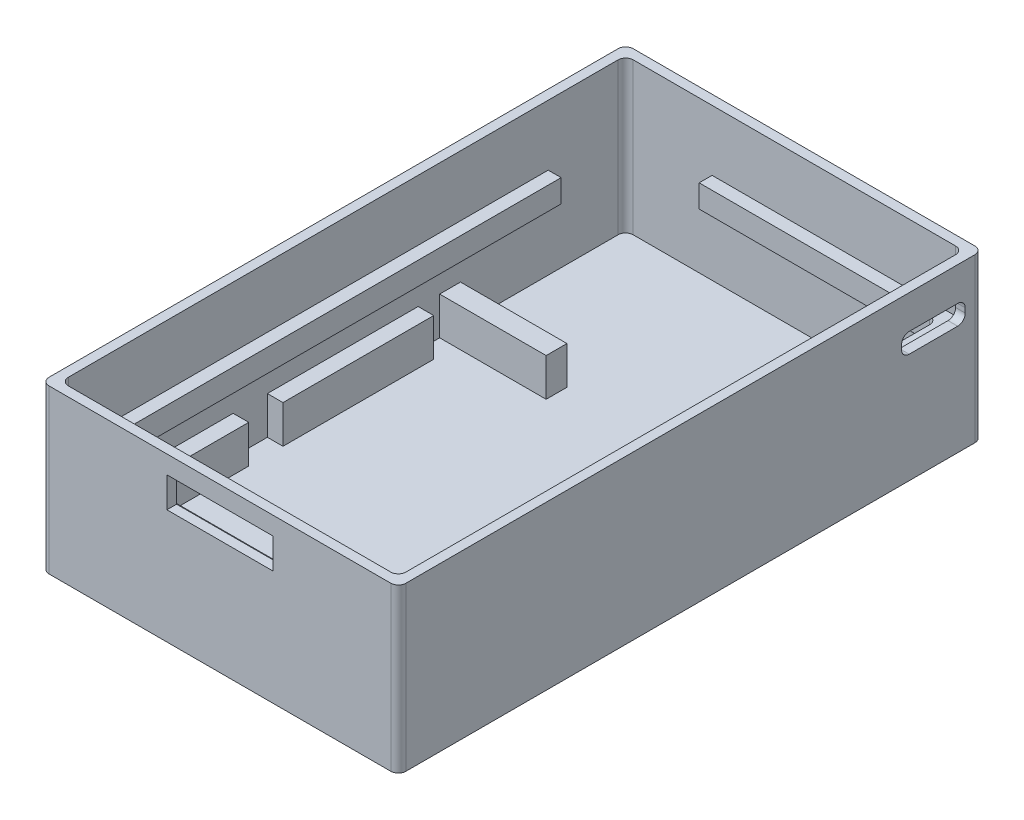
from build123d import *

# Parameters (mm, degrees)
SKETCH1_W           = 47.09116882
SKETCH1_H           = 77.09116882
BOSS_EXTRUDE1_DEPTH = 1.5
SKETCH2_W           = 47.09116882
SKETCH2_H           = 77.09116882
SKETCH2_W_2         = 44.545584412
SKETCH2_H_2         = 74.545584412
BOSS_EXTRUDE2_DEPTH = 20
FILLET4_R           = 1
SKETCH9_W           = 8.4
SKETCH9_H           = 2.6
CUT_EXTRUDE4_DEPTH  = 2
FILLET5_R           = 1
SKETCH10_W          = 2.5
SKETCH10_H          = 19.895622202
SKETCH10_W_2        = 15
SKETCH10_H_2        = 2.746977623
BOSS_EXTRUDE4_DEPTH = 5
SKETCH11_W          = 14
SKETCH11_H          = 4
CUT_EXTRUDE5_DEPTH  = 10
SKETCH12_W          = 75.09116882
SKETCH12_H          = 3
BOSS_EXTRUDE5_DEPTH = 46
SKETCH13_W          = 41.13137085
SKETCH13_H          = 71.13137085
CUT_EXTRUDE6_DEPTH  = 3
FILLET6_R           = 1
CUT_EXTRUDE8_DEPTH  = 3


with BuildPart() as part:
    # Sketch1 → Boss-Extrude1 (new body)
    with BuildSketch(Plane(origin=(0, 0, 0), x_dir=(1, 0, 0), z_dir=(0, 1, 0))):
        with Locations((23.54558441, -38.54558441)):
            Rectangle(SKETCH1_W, SKETCH1_H)
    extrude(amount=BOSS_EXTRUDE1_DEPTH)

    # Sketch2 → Boss-Extrude2 (add)
    with BuildSketch(Plane(origin=(0, 1.5, 0), x_dir=(1, 0, 0), z_dir=(0, 1, 0))):
        with Locations((23.54558441, -38.54558441)):
            Rectangle(SKETCH2_W, SKETCH2_H)
        with Locations((23.545584412, -38.545584412)):
            Rectangle(SKETCH2_W_2, SKETCH2_H_2, mode=Mode.SUBTRACT)
    extrude(amount=BOSS_EXTRUDE2_DEPTH)

    # Fillet4
    fillet4_edges = [part.edges().sort_by_distance(p)[0] for p in [
        (1.272792206, 11.5, 75.818376618),
        (45.818376618, 11.5, 75.818376618),
        (45.818376618, 11.5, 1.272792206),
        (1.272792206, 11.5, 1.272792206),
        (0, 10.75, 0),
        (47.09116882, 10.75, 0),
        (47.09116882, 10.75, 77.09116882),
        (0, 10.75, 77.09116882),
    ]]
    fillet(fillet4_edges, radius=FILLET4_R)

    # Sketch9 → Cut-Extrude4 (cut)
    with BuildSketch(Plane(origin=(47.09116882, 0, 0), x_dir=(0, 0, -1), z_dir=(1, 0, 0))):
        with Locations((-6.471655529, 15.764642051)):
            Rectangle(SKETCH9_W, SKETCH9_H)
    extrude(amount=-CUT_EXTRUDE4_DEPTH, mode=Mode.SUBTRACT)

    # Fillet5
    # the kernel refuses this fillet: 1 mm, written as the material it adds along each edge
    with BuildSketch(Plane(origin=(47.09116882, 17.064642051, 10.671655529), x_dir=(0, 0, -1), z_dir=(-1, 0, 0))) as fillet5_piece_1:
        with BuildLine():
            CenterArc((FILLET5_R, FILLET5_R), FILLET5_R, 180, 90)
            Line((0, FILLET5_R), (0, 0))
            Line((0, 0), (FILLET5_R, 0))
        make_face()
    extrude(amount=1.272792202)
    with BuildSketch(Plane(origin=(47.09116882, 14.464642051, 2.271655529), x_dir=(0, 0, 1), z_dir=(-1, 0, 0))) as fillet5_piece_2_section:
        with BuildLine():
            CenterArc((FILLET5_R, FILLET5_R), FILLET5_R, 180, 90)
            Line((0, FILLET5_R), (0, 0))
            Line((0, 0), (FILLET5_R, 0))
        make_face()
    fillet5_piece_2 = extrude(amount=3.772792848, mode=Mode.PRIVATE)
    fillet5_piece_2 = split(fillet5_piece_2, bisect_by=Plane(origin=(45.818376618, 14.688009946, 2.495023498), z_dir=(1, 0, 0)), keep=Keep.TOP, mode=Mode.PRIVATE)
    add(fillet5_piece_2)
    with BuildSketch(Plane(origin=(47.09116882, 17.064642051, 2.271655529), x_dir=(0, -1, 0), z_dir=(-1, 0, 0))) as fillet5_piece_3_section:
        with BuildLine():
            CenterArc((FILLET5_R, FILLET5_R), FILLET5_R, 180, 90)
            Line((0, FILLET5_R), (0, 0))
            Line((0, 0), (FILLET5_R, 0))
        make_face()
    fillet5_piece_3 = extrude(amount=3.772792848, mode=Mode.PRIVATE)
    fillet5_piece_3 = split(fillet5_piece_3, bisect_by=Plane(origin=(45.818376618, 16.841274155, 2.495023498), z_dir=(1, 0, 0)), keep=Keep.TOP, mode=Mode.PRIVATE)
    add(fillet5_piece_3)
    with BuildSketch(Plane(origin=(47.09116882, 14.464642051, 10.671655529), x_dir=(0, 0, -1), z_dir=(-1, 0, 0))) as fillet5_piece_4:
        with BuildLine():
            CenterArc((FILLET5_R, -FILLET5_R), FILLET5_R, 90, 90)
            Line((0, -FILLET5_R), (0, 0))
            Line((0, 0), (FILLET5_R, 0))
        make_face()
    extrude(amount=1.272792202)

    # Sketch10 → Boss-Extrude4 (add)
    with BuildSketch(Plane(origin=(0, 1.5, 0), x_dir=(1, 0, 0), z_dir=(0, 1, 0))):
        with Locations((2.082813384, -63.025844565)):
            Rectangle(SKETCH10_W, SKETCH10_H)
        with Locations((7.824900782, -24.444887807)):
            Rectangle(SKETCH10_W_2, SKETCH10_H_2)
        with Locations((39.244805213, -24.444887807)):
            Rectangle(SKETCH10_W_2, SKETCH10_H_2)
        with Locations((2.082813384, -38.610908672)):
            Rectangle(SKETCH10_W, SKETCH10_H)
        with Locations((45.295584412, -38.610908672)):
            Rectangle(SKETCH10_W, SKETCH10_H)
        with Locations((45.295584412, -63.025844565)):
            Rectangle(SKETCH10_W, SKETCH10_H)
    extrude(amount=BOSS_EXTRUDE4_DEPTH)

    # Sketch11 → Cut-Extrude5 (cut)
    with BuildSketch(Plane.XY.offset(77.09116882)):
        with Locations((23.545584412, 17.117945241)):
            Rectangle(SKETCH11_W, SKETCH11_H)
    extrude(amount=-CUT_EXTRUDE5_DEPTH, mode=Mode.SUBTRACT)

    # Sketch12 → Boss-Extrude5 (add)
    with BuildSketch(Plane(origin=(47.09116882, 0, 0), x_dir=(0, 0, -1), z_dir=(1, 0, 0))):
        with Locations((-38.54558441, 12)):
            Rectangle(SKETCH12_W, SKETCH12_H)
    extrude(amount=-BOSS_EXTRUDE5_DEPTH)

    # Sketch13 → Cut-Extrude6 (cut)
    with BuildSketch(Plane(origin=(0, 13.5, 0), x_dir=(1, 0, 0), z_dir=(0, 1, 0))):
        with Locations((23.545584412, -38.545584412)):
            Rectangle(SKETCH13_W, SKETCH13_H)
    extrude(amount=-CUT_EXTRUDE6_DEPTH, mode=Mode.SUBTRACT)

    # Fillet6
    fillet6_edges = [part.edges().sort_by_distance(p)[0] for p in [
        (44.111269837, 12, 74.111269837),
        (2.979898987, 12, 74.111269837),
        (2.979898987, 12, 2.979898987),
        (44.111269837, 12, 2.979898987),
    ]]
    fillet(fillet6_edges, radius=FILLET6_R)

    # Sketch14 → Cut-Extrude8 (cut)
    with BuildSketch(Plane(origin=(0, 13.5, 0), x_dir=(1, 0, 0), z_dir=(0, 1, 0))):
        with BuildLine():
            Line((1.272792206, -11.492184631), (12.679197534, -11.492184631))
            Line((12.679197534, -11.492184631), (12.679197534, -1.272792206))
            Line((12.679197534, -1.272792206), (2.272792206, -1.272792206))
            ThreePointArc((2.272792206, -1.272792206), (1.565685425, -1.565685425), (1.272792206, -2.272792206))
            Line((1.272792206, -2.272792206), (1.272792206, -11.492184631))
        make_face()
    extrude(amount=-CUT_EXTRUDE8_DEPTH, mode=Mode.SUBTRACT)


solid = part.part
